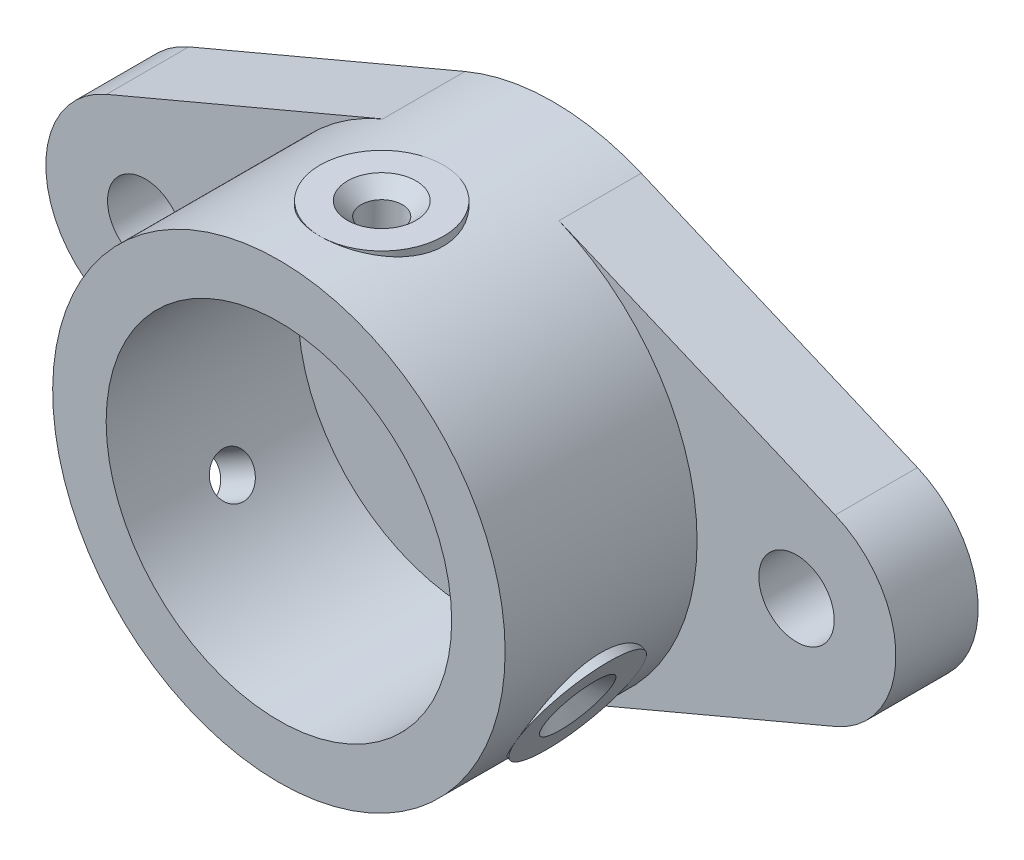
from build123d import *

# Parameters (mm, degrees)
SKETCH1_R                = 16.5
SKETCH1_R_2              = 12.6
BOSS_EXTRUDE1_DEPTH      = 15
BOSS_EXTRUDE2_START      = 5
SKETCH2_R                = 16.5
BOSS_EXTRUDE2_DEPTH      = 5
BOSS_EXTRUDE3_REACH      = 41.828
BOSS_EXTRUDE3_END_RADIUS = 16.5
SKETCH3_R                = 4.5
CUT_EXTRUDE1_REACH       = 41.828
CUT_EXTRUDE1_END_RADIUS  = 12.6
SKETCH4_R                = 1.5
CIRPATTERN1_COUNT        = 3
CHAMFER1_SIZE            = 1
SKETCH5_R                = 2.75
BOSS_EXTRUDE4_DEPTH      = 6


with BuildPart() as part:
    # Sketch1 → Boss-Extrude1 (new body)
    with BuildSketch(Plane.XY):
        Circle(SKETCH1_R)
        Circle(SKETCH1_R_2, mode=Mode.SUBTRACT)
    extrude(amount=BOSS_EXTRUDE1_DEPTH)

    # Sketch2 → Boss-Extrude2 (add)
    with BuildSketch(Plane(origin=(0, 0, 0), x_dir=(-1, 0, 0), z_dir=(0, 0, -1)).offset(BOSS_EXTRUDE2_START)):
        Circle(SKETCH2_R)
    extrude(amount=-BOSS_EXTRUDE2_DEPTH)

    # Boss-Extrude3: up to this cylinder (the profile starts outside it)
    boss_extrude3_end = Plane(origin=(0, 0, 7.5), z_dir=(0, 0, -1)) * Cylinder(BOSS_EXTRUDE3_END_RADIUS, 117.656, mode=Mode.PRIVATE)
    # Sketch3 → Boss-Extrude3 (add, up to the surface)
    with BuildSketch(Plane(origin=(0, 16.5, 0), x_dir=(1, 0, 0), z_dir=(0, 1, 0)), mode=Mode.PRIVATE) as boss_extrude3_sk1:
        with Locations((0, -7.5)):
            Circle(SKETCH3_R)
    boss_extrude3_tool1 = extrude(boss_extrude3_sk1.sketch, amount=-BOSS_EXTRUDE3_REACH, mode=Mode.PRIVATE) - boss_extrude3_end
    boss_extrude3 = boss_extrude3_tool1.solids().sort_by_distance((0, 16.5, 7.5))[0] + boss_extrude3_tool1.solids().sort_by_distance((0, 16.5, 7.5))[1]
    add(boss_extrude3)

    # Cut-Extrude1: up to this cylinder (the profile starts outside it)
    cut_extrude1_end = Plane(origin=(0, 0, 7.5), z_dir=(0, 0, -1)) * Cylinder(CUT_EXTRUDE1_END_RADIUS, 109.856, mode=Mode.PRIVATE)
    # Sketch4 → Cut-Extrude1 (cut, up to the surface)
    with BuildSketch(Plane(origin=(0, 16.5, 0), x_dir=(1, 0, 0), z_dir=(0, 1, 0)), mode=Mode.PRIVATE) as cut_extrude1_sk1:
        with Locations((0, -7.5)):
            Circle(SKETCH4_R)
    cut_extrude1_tool1 = extrude(cut_extrude1_sk1.sketch, amount=-CUT_EXTRUDE1_REACH, mode=Mode.PRIVATE) - cut_extrude1_end
    cut_extrude1 = cut_extrude1_tool1.solids().sort_by_distance((0, 16.5, 7.5))[0]
    add(cut_extrude1, mode=Mode.SUBTRACT)

    # CirPattern1: Boss-Extrude3, Cut-Extrude1 ×3 about axis
    cirpattern1_axis = Axis((0, 0, 15), (0, 0, 1))
    add([boss_extrude3.rotate(cirpattern1_axis, i * 360 / CIRPATTERN1_COUNT) for i in range(1, CIRPATTERN1_COUNT)])
    add([cut_extrude1.rotate(cirpattern1_axis, i * 360 / CIRPATTERN1_COUNT) for i in range(1, CIRPATTERN1_COUNT)], mode=Mode.SUBTRACT)

    # Chamfer1
    chamfer1_edges = [part.edges().sort_by_distance(p)[0] for p in [
        (-13.539419162, -9.549038106, 7.5),
        (15.039419162, -6.950961894, 7.5),
        (-1.5, 16.5, 7.5),
    ]]
    chamfer(chamfer1_edges, length=CHAMFER1_SIZE)

    # Sketch5 → Boss-Extrude4 (add)
    with BuildSketch(Plane(origin=(0, 0, -5), x_dir=(-1, 0, 0), z_dir=(0, 0, -1))):
        with BuildLine():
            Line((26.573684211, 6.677522556), (6.426315789, 15.197120299))
            ThreePointArc((6.426315789, 15.197120299), (0, 16.5), (-6.426315789, 15.197120299))
            Line((-6.426315789, 15.197120299), (-26.573684211, 6.677522556))
            ThreePointArc((-26.573684211, 6.677522556), (-31, 0), (-26.573684211, -6.677522556))
            Line((-26.573684211, -6.677522556), (-6.426315789, -15.197120299))
            ThreePointArc((-6.426315789, -15.197120299), (0, -16.5), (6.426315789, -15.197120299))
            Line((6.426315789, -15.197120299), (26.573684211, -6.677522556))
            ThreePointArc((26.573684211, -6.677522556), (31, 0), (26.573684211, 6.677522556))
        make_face()
        with Locations((23.75, 0)):
            Circle(SKETCH5_R, mode=Mode.SUBTRACT)
        with Locations((-23.75, 0)):
            Circle(SKETCH5_R, mode=Mode.SUBTRACT)
    extrude(amount=-BOSS_EXTRUDE4_DEPTH)


solid = part.part
